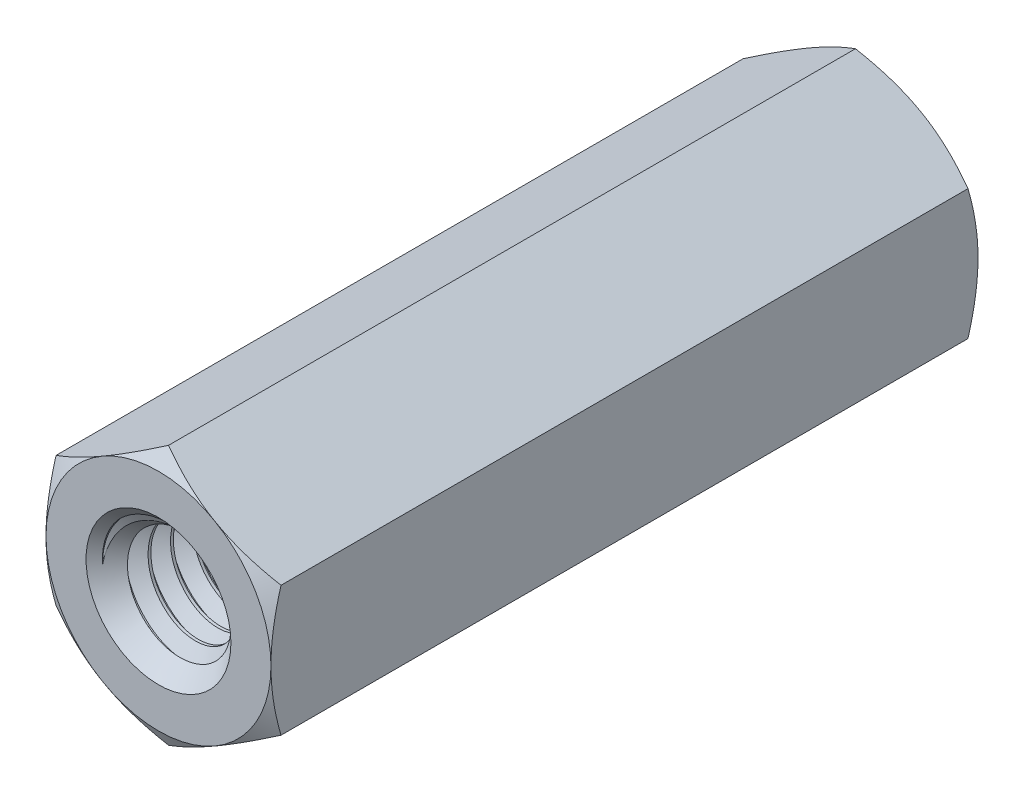
from build123d import *

# Parameters (mm, degrees)
EXTRUDE1_DEPTH     = 22
SKETCH2_OUTSIDE_W  = 95.784
SKETCH2_OUTSIDE_H  = 96.866
SKETCH2_OUTSIDE_R  = 3.5
CUT_EXTRUDE1_DEPTH = 23.640303296
CUT_EXTRUDE1_DRAFT = -60
SKETCH3_OUTSIDE_W  = 95.784
SKETCH3_OUTSIDE_H  = 96.866
SKETCH3_OUTSIDE_R  = 3.5
CUT_EXTRUDE2_DEPTH = 23.640303296
CUT_EXTRUDE2_DRAFT = -60
SKETCH4_R          = 2
CUT_EXTRUDE3_DEPTH = 23.640303296
SKETCH12_R         = 2
SKETCH12_R_2       = 1.545336663
EXTRUDE2_DEPTH     = 22
CUT_SWEEP1_PITCH   = 0.7


with BuildPart() as part:
    # Sketch1 → Extrude1 (new body)
    with BuildSketch(Plane.XY):
        Polygon((0, 4.041451884), (-3.5, 2.020725942), (-3.5, -2.020725942), (0, -4.041451884), (3.5, -2.020725942), (3.5, 2.020725942), align=None)
    extrude(amount=-EXTRUDE1_DEPTH)


with BuildPart() as cut_extrude1_tool:
    # Sketch2 outside → Cut-Extrude1 (with draft: the straight prism first)
    with BuildSketch(Plane.XY):
        Rectangle(SKETCH2_OUTSIDE_W, SKETCH2_OUTSIDE_H)
        Circle(SKETCH2_OUTSIDE_R, mode=Mode.SUBTRACT)
    extrude(amount=-CUT_EXTRUDE1_DEPTH)
    # Cut-Extrude1: the draft: its side faces are tilted about the plane it starts from
    cut_extrude1_sides = [cut_extrude1_tool.faces().sort_by_distance(p)[0] for p in [
        (0, -48.433, -11.820151648),
        (47.892, 0, -11.820151648),
        (0, 48.433, -11.820151648),
        (-47.892, 0, -11.820151648),
        (-3.5, 0, -11.820151648),
    ]]
    draft(cut_extrude1_sides, Plane.XY, CUT_EXTRUDE1_DRAFT)


with BuildPart() as part_1:
    add(part.part)

    # Cut-Extrude1: cut by cut_extrude1_tool
    add(cut_extrude1_tool.part, mode=Mode.SUBTRACT)


with BuildPart() as cut_extrude2_tool:
    # Sketch3 outside → Cut-Extrude2 (with draft: the straight prism first)
    with BuildSketch(Plane(origin=(0, 0, -22), x_dir=(-1, 0, 0), z_dir=(0, 0, -1))):
        Rectangle(SKETCH3_OUTSIDE_W, SKETCH3_OUTSIDE_H)
        Circle(SKETCH3_OUTSIDE_R, mode=Mode.SUBTRACT)
    extrude(amount=-CUT_EXTRUDE2_DEPTH)
    # Cut-Extrude2: the draft: its side faces are tilted about the plane it starts from
    cut_extrude2_sides = [cut_extrude2_tool.faces().sort_by_distance(p)[0] for p in [
        (0, -48.433, -10.179848352),
        (-47.892, 0, -10.179848352),
        (0, 48.433, -10.179848352),
        (47.892, 0, -10.179848352),
        (3.5, 0, -10.179848352),
    ]]
    draft(cut_extrude2_sides, Plane(origin=(0, 0, -22), x_dir=(-1, 0, 0), z_dir=(0, 0, -1)), CUT_EXTRUDE2_DRAFT)


with BuildPart() as part_2:
    add(part_1.part)

    # Cut-Extrude2: cut by cut_extrude2_tool
    add(cut_extrude2_tool.part, mode=Mode.SUBTRACT)

    # Sketch4 → Cut-Extrude3 (cut, through all)
    with BuildSketch(Plane.XY):
        Circle(SKETCH4_R)
    extrude(amount=-CUT_EXTRUDE3_DEPTH, mode=Mode.SUBTRACT)

    # Sketch12 → Extrude2 (add)
    with BuildSketch(Plane.XY):
        Circle(SKETCH12_R)
        Circle(SKETCH12_R_2, mode=Mode.SUBTRACT)
    extrude(amount=-EXTRUDE2_DEPTH)

    # Cut-Sweep1: arcs per turn and ends read off the stored shape
    # Cut-Sweep1: the profile of Sketch9 profile screwed along a right-hand helix through 33 turns, 6 arcs to a turn; built about Z, then put on its axis
    cut_sweep1_z = Axis((0, 0, 0), (0, 0, 1))
    cut_sweep1_corners = [(2, 0, -0.35), (2, 0, -0.2625), (1.545036663, 0, 0.000173205), (1.545036663, 0, -0.612673205)]
    with BuildLine(mode=Mode.PRIVATE) as cut_sweep1_profile:
        Line(cut_sweep1_corners[0], cut_sweep1_corners[1])
        Line(cut_sweep1_corners[1], cut_sweep1_corners[2])
        Line(cut_sweep1_corners[2], cut_sweep1_corners[3])
        Line(cut_sweep1_corners[3], cut_sweep1_corners[0])
    cut_sweep1_cap = Face(cut_sweep1_profile.wire())
    cut_sweep1_turn_angles = [0, 30, 60, 90, 120, 150, 180, 210, 240, 270, 300, 330, 360]
    cut_sweep1_turn_weights = [1, 0.8660254037844387, 1, 0.8660254037844387, 1, 0.8660254037844387, 1, 0.8660254037844387, 1, 0.8660254037844387, 1, 0.8660254037844387, 1]
    cut_sweep1_turn_rails = [Edge.make_bspline([Vector(p[0], p[1], 0).rotate(cut_sweep1_z, cut_sweep1_turn_angles[k]) / cut_sweep1_turn_weights[k] + Vector(0, 0, p[2] + CUT_SWEEP1_PITCH * cut_sweep1_turn_angles[k] / 360) for k in range(13)], [0, 0, 0, 1, 1, 2, 2, 3, 3, 4, 4, 5, 5, 6, 6, 6], 2, cut_sweep1_turn_weights) for p in cut_sweep1_corners]
    cut_sweep1_turn_sides = [Face.make_surface_from_curves(cut_sweep1_turn_rails[p[0]], cut_sweep1_turn_rails[p[1]]) for p in [(0, 1), (1, 2), (2, 3), (3, 0)]]
    cut_sweep1 = Plane(origin=(0, 0, 0), x_dir=(0, 1, 0), z_dir=(0, 0, -1)) * Solid(Shell([*[p.moved(Location((0, 0, CUT_SWEEP1_PITCH * i))) for i in range(33) for p in cut_sweep1_turn_sides], cut_sweep1_cap, cut_sweep1_cap.rotate(cut_sweep1_z, 11880).moved(Location((0, 0, CUT_SWEEP1_PITCH * 11880 / 360)))]))
    add(cut_sweep1, mode=Mode.SUBTRACT)

    # Cut-Extrude6 cone 1 section (through the dimple's axis) → Cut-Extrude6 (revolve, cut)
    with BuildSketch(Plane(origin=(0, 0, 0), x_dir=(0, -1, 0), z_dir=(1, 0, 0))):
        Polygon((0, 0), (2.254, 0), (0, 2.254), align=None)
    revolve(axis=Axis((0, 0, 0), (0, 0, -1)), mode=Mode.SUBTRACT)

    # Cut-Extrude7 cone 1 section (through the dimple's axis) → Cut-Extrude7 (revolve, cut)
    with BuildSketch(Plane(origin=(0, 0, -22), x_dir=(0, 1, 0), z_dir=(1, 0, 0))):
        Polygon((0, 0), (2.254, 0), (0, 2.254), align=None)
    revolve(axis=Axis((0, 0, -22), (0, 0, 1)), mode=Mode.SUBTRACT)


solid = part_2.part
